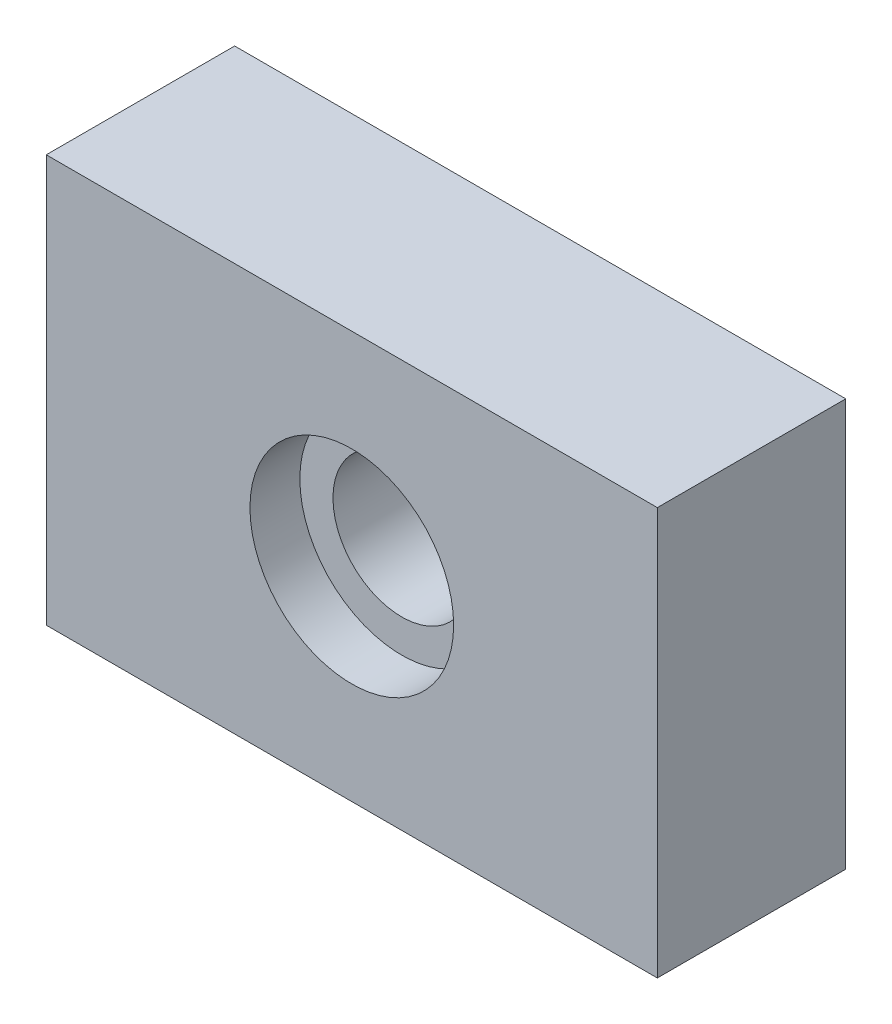
from build123d import *

# Parameters (mm, degrees)
SKETCH1_W                       = 152.4
SKETCH1_H                       = 101.6
BOSS_EXTRUDE1_DEPTH             = 46.99
SKETCH2_R                       = 17.145
CUT_EXTRUDE1_DEPTH              = 190.093574983
SKETCH2_2_R                     = 25.4
SKETCH2_2_R_2                   = 17.145
CUT_EXTRUDE3_DEPTH              = 12.446
TAP_DRILL_FOR_1_2_13_TAP1_D     = 10.71626
TAP_DRILL_FOR_1_2_13_TAP1_DEPTH = 12.7
TAP_DRILL_FOR_1_2_13_TAP1_TIP   = 3.219489309


with BuildPart() as part:
    # Sketch1 → Boss-Extrude1 (new body)
    with BuildSketch(Plane.XY):
        with Locations((76.2, 50.8)):
            Rectangle(SKETCH1_W, SKETCH1_H)
    extrude(amount=BOSS_EXTRUDE1_DEPTH)

    # Sketch2 → Cut-Extrude1 (cut, through all)
    with BuildSketch(Plane(origin=(0, 0, 0), x_dir=(-1, 0, 0), z_dir=(0, 0, -1))):
        with Locations((-76.2, 50.8)):
            Circle(SKETCH2_R)
    extrude(amount=-CUT_EXTRUDE1_DEPTH, mode=Mode.SUBTRACT)

    # Sketch2<2> → Cut-Extrude3 (cut)
    with BuildSketch(Plane(origin=(0, 0, 0), x_dir=(-1, 0, 0), z_dir=(0, 0, -1))):
        with Locations((-76.2, 50.8)):
            Circle(SKETCH2_2_R)
        with Locations((-76.2, 50.8)):
            Circle(SKETCH2_2_R_2, mode=Mode.SUBTRACT)
    cut_extrude3 = extrude(amount=-CUT_EXTRUDE3_DEPTH, mode=Mode.SUBTRACT)

    # Mirror2: Cut-Extrude3 across plane
    add(cut_extrude3.mirror(Plane(origin=(0, 0, 23.495), x_dir=(1, 0, 0), z_dir=(0, 0, -1))), mode=Mode.SUBTRACT)

    # Tap Drill for 1/2-13 Tap1
    with Locations(Plane(origin=(0, 0, 0), x_dir=(-1, 0, 0), z_dir=(0, -1, 0))):
        with Locations((-95.25, -23.495), (-57.15, -23.495)):
            Hole(TAP_DRILL_FOR_1_2_13_TAP1_D / 2, depth=TAP_DRILL_FOR_1_2_13_TAP1_DEPTH)
            with Locations((0, 0, -(TAP_DRILL_FOR_1_2_13_TAP1_DEPTH + TAP_DRILL_FOR_1_2_13_TAP1_TIP / 2))):  # 118° drill point
                Cone(0, TAP_DRILL_FOR_1_2_13_TAP1_D / 2, TAP_DRILL_FOR_1_2_13_TAP1_TIP, mode=Mode.SUBTRACT)


solid = part.part
